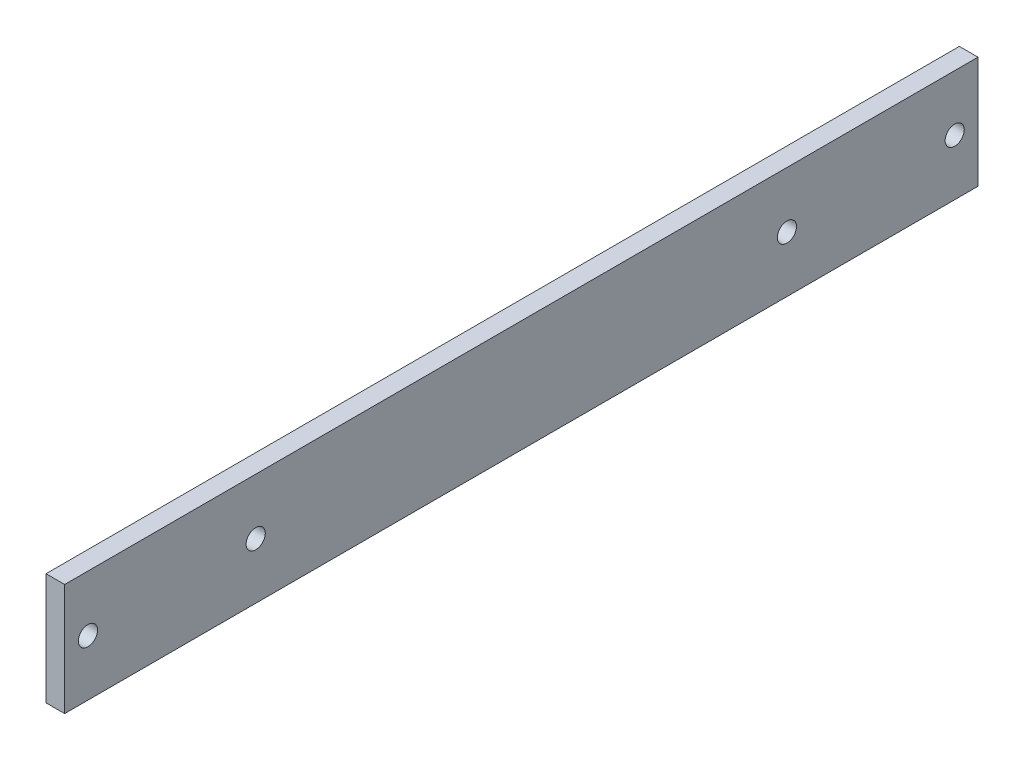
from build123d import *

# Parameters (mm, degrees)
SKETCH1_W                   = 6.35
SKETCH1_H                   = 38.1
BOSS_EXTRUDE1_DEPTH         = 155.575
F_1_4_CLEARANCE_HOLE1_D     = 6.5278
F_1_4_CLEARANCE_HOLE1_DEPTH = 82.55
F_1_4_CLEARANCE_HOLE1_TIP   = 1.961148974


with BuildPart() as part:
    # Sketch1 → Boss-Extrude1 (new, symmetric)
    with BuildSketch(Plane.XY):
        Rectangle(SKETCH1_W, SKETCH1_H)
    extrude(amount=BOSS_EXTRUDE1_DEPTH, both=True)

    # 1/4 Clearance Hole1
    with Locations(Plane(origin=(3.175, 0, 0), x_dir=(0, 0, -1), z_dir=(1, 0, 0))):
        with Locations((-147.6375, 0), (-90.4875, 0), (90.4875, 0), (147.6375, 0)):
            Hole(F_1_4_CLEARANCE_HOLE1_D / 2, depth=F_1_4_CLEARANCE_HOLE1_DEPTH)
            with Locations((0, 0, -(F_1_4_CLEARANCE_HOLE1_DEPTH + F_1_4_CLEARANCE_HOLE1_TIP / 2))):  # 118° drill point
                Cone(0, F_1_4_CLEARANCE_HOLE1_D / 2, F_1_4_CLEARANCE_HOLE1_TIP, mode=Mode.SUBTRACT)


solid = part.part
